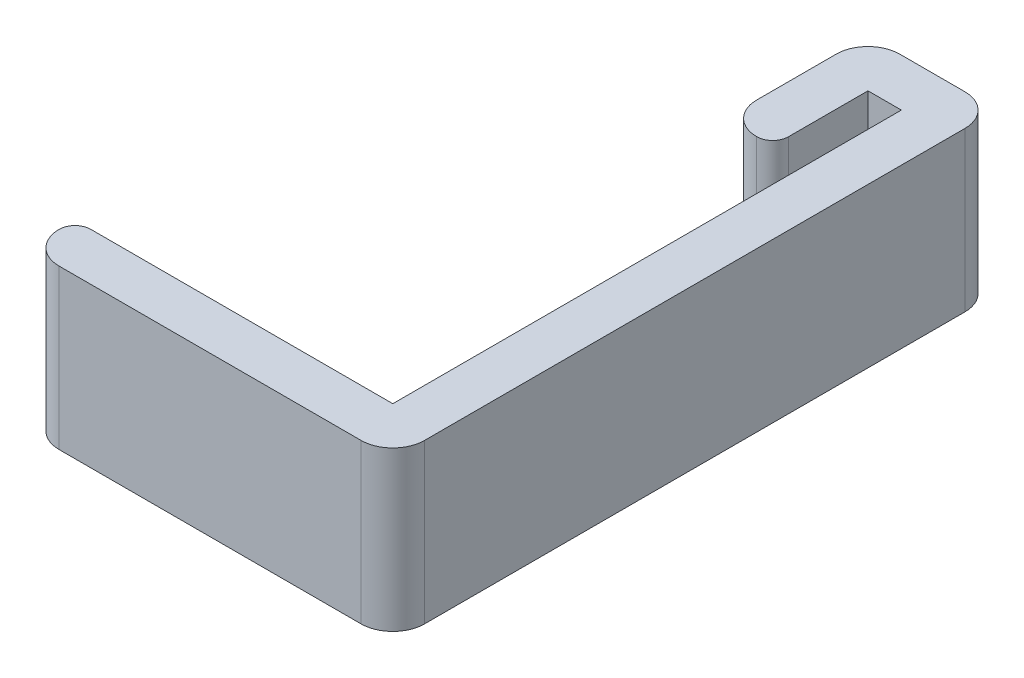
from build123d import *

# Parameters (mm, degrees)
BOSS_EXTRUDE1_DEPTH = 10
FILLET1_R           = 2
FILLET2_R           = 2
FILLET3_R           = 2
FILLET4_R           = 2
FILLET5_R           = 1
FILLET6_R           = 2
FILLET7_R           = 1


with BuildPart() as part:
    # Sketch1 → Boss-Extrude1 (new body)
    with BuildSketch(Plane(origin=(0, 0, 0), x_dir=(1, 0, 0), z_dir=(0, 1, 0))):
        Polygon((0, 0), (0, 6), (2.1, 6), (2.1, -26), (-17.9, -26), (-17.9, -29), (5.1, -29), (5.1, 9), (-3, 9), (-3, 0), align=None)
    extrude(amount=BOSS_EXTRUDE1_DEPTH)

    # Fillet1
    fillet1_edges = [part.edges().sort_by_distance(p)[0] for p in [
        (5.1, 5, -9),
    ]]
    fillet(fillet1_edges, radius=FILLET1_R)

    # Fillet2
    fillet2_edges = [part.edges().sort_by_distance(p)[0] for p in [
        (5.1, 5, 29),
    ]]
    fillet(fillet2_edges, radius=FILLET2_R)

    # Fillet3
    fillet3_edges = [part.edges().sort_by_distance(p)[0] for p in [
        (-17.9, 5, 29),
    ]]
    fillet(fillet3_edges, radius=FILLET3_R)

    # Fillet4
    fillet4_edges = [part.edges().sort_by_distance(p)[0] for p in [
        (-3, 5, -9),
    ]]
    fillet(fillet4_edges, radius=FILLET4_R)

    # Fillet5
    fillet5_edges = [part.edges().sort_by_distance(p)[0] for p in [
        (-17.9, 5, 26),
    ]]
    fillet(fillet5_edges, radius=FILLET5_R - 0.0001)  # a hair under: the kernel refuses the full size

    # Fillet6
    fillet6_edges = [part.edges().sort_by_distance(p)[0] for p in [
        (-3, 5, 0),
    ]]
    fillet(fillet6_edges, radius=FILLET6_R)

    # Fillet7
    fillet7_edges = [part.edges().sort_by_distance(p)[0] for p in [
        (0, 5, 0),
    ]]
    fillet(fillet7_edges, radius=FILLET7_R - 0.0001)  # a hair under: the kernel refuses the full size


solid = part.part
